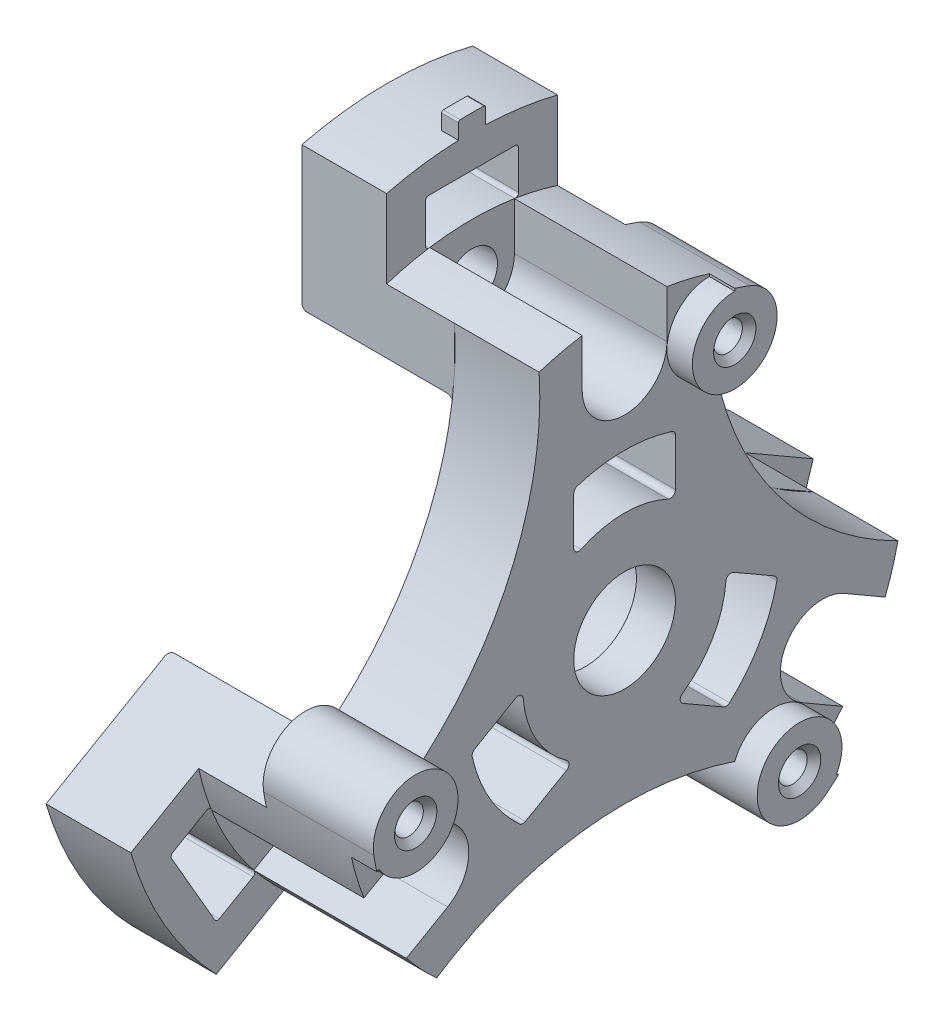
from build123d import *
from build123d.topology import SkipClean

# Parameters (mm, degrees)
SKETCH_2_R                           = 20
CUT_EXTRUDE_1_DEPTH                  = 10
PATTERN_CIRCULAR_1_COUNT             = 3
CUT_EXTRUDE_START                    = -10
CUT_EXTRUDE_2_DEPTH                  = 10
PATTERN_CIRCULAR_2_COUNT             = 3
SKETCH_4_R                           = 1.5
EXTRUDE_1_DEPTH                      = 9
PATTERN_CIRCULAR_3_COUNT             = 3
CUT_EXTRUDE_START_2                  = -1.7
CUT_EXTRUDE_3_DEPTH                  = 1.7
PATTERN_CIRCULAR_4_COUNT             = 3
CUT_EXTRUDE_4_DEPTH                  = 9
PATTERN_CIRCULAR_5_COUNT             = 3
EXTRUDE_START                        = -6.5
EXTRUDE_2_DEPTH                      = 6.5
SKETCH_9_R                           = 0.85
CUT_EXTRUDE_7_DEPTH                  = 6.4
CHAMFER_3_SIZE                       = 0.4
PATTERN_CIRCULAR_8_COUNT             = 3
CHAMFER_3_OF_PATTERN_CIRCULAR_8_SIZE = 0.4
CHAMFER_4_SIZE                       = 0.3
CHAMFER_4_SIZE2                      = 0.519615242
FILLET_6_R                           = 0.5
FILLET_7_R                           = 0.5
EXTRUDE_START_2                      = -5
EXTRUDE_3_DEPTH                      = 5
PATTERN_CIRCULAR_9_COUNT             = 3
EXTRUDE_4_DEPTH                      = 1
FILLET_9_R                           = 0.3
FILLET_10_R                          = 0.2


with BuildPart() as part:
    # 草图1 → 旋转1 (revolve)
    with BuildSketch(Plane.XY, mode=Mode.PRIVATE) as revolve_1_sk:
        Polygon((-7, 6), (-5, 6), (-5, 16.5), (0, 16.5), (0, 3), (-2.3, 3), (-2.3, 3.975), (-7, 3.975), align=None)
    revolve(revolve_1_sk.sketch.rotate(Axis((-65.742857143, 0, 0), (1, 0, 0)), 90), axis=Axis((-65.742857143, 0, 0), (1, 0, 0)))

    # 草图2 → 切除-拉伸1 (cut)
    with BuildSketch(Plane.ZY.offset(5)):
        with Locations((-25, 14.43375673)):
            Circle(SKETCH_2_R)
    cut_extrude_1 = extrude(amount=-CUT_EXTRUDE_1_DEPTH, mode=Mode.SUBTRACT)

    # 阵列(圆周)1: 切除-拉伸1 ×3 about axis
    pattern_circular_1_axis = Axis((0, 0, 0), (1, 0, 0))
    for i in range(1, PATTERN_CIRCULAR_1_COUNT):
        add(cut_extrude_1.rotate(pattern_circular_1_axis, i * 360 / PATTERN_CIRCULAR_1_COUNT), mode=Mode.SUBTRACT)

    # 草图3 → 切除-拉伸2 (cut)
    with BuildSketch(Plane.ZY.offset(5).offset(CUT_EXTRUDE_START)):
        with BuildLine():
            Line((-3, 8.480566019), (-3, 5.692099788))
            ThreePointArc((-3, 5.692099788), (-2.860356745, 5.438553512), (-2.571428571, 5.421047417))
            ThreePointArc((-2.571428571, 5.421047417), (0, 6), (2.571428571, 5.421047417))
            ThreePointArc((2.571428571, 5.421047417), (2.860356745, 5.438553512), (3, 5.692099788))
            Line((3, 5.692099788), (3, 8.480566019))
            ThreePointArc((3, 8.480566019), (2.9421811, 8.657620571), (2.791011236, 8.766427795))
            ThreePointArc((2.791011236, 8.766427795), (0, 9.2), (-2.791011236, 8.766427795))
            ThreePointArc((-2.791011236, 8.766427795), (-2.9421811, 8.657620571), (-3, 8.480566019))
        make_face()
    cut_extrude_2 = extrude(amount=CUT_EXTRUDE_2_DEPTH, mode=Mode.SUBTRACT)

    # 阵列(圆周)2: 切除-拉伸2 ×3 about axis
    pattern_circular_2_axis = Axis((0, 0, 0), (1, 0, 0))
    for i in range(1, PATTERN_CIRCULAR_2_COUNT):
        add(cut_extrude_2.rotate(pattern_circular_2_axis, i * 360 / PATTERN_CIRCULAR_2_COUNT), mode=Mode.SUBTRACT)

    # 草图4 → 凸台-拉伸1 (add)
    with BuildSketch(Plane.ZY.offset(5)):
        with BuildLine():
            Line((-5.040834524, 15.711142139), (-5.040834524, 11.928641469))
            ThreePointArc((-5.040834524, 11.928641469), (-3.875431802, 12.356517647), (-2.674412578, 12.670833333))
            ThreePointArc((-2.674412578, 12.670833333), (0, 10.7), (2.674412578, 12.670833333))
            ThreePointArc((2.674412578, 12.670833333), (3.875431802, 12.356517647), (5.040834524, 11.928641469))
            Line((5.040834524, 11.928641469), (5.040834524, 15.711142139))
            ThreePointArc((5.040834524, 15.711142139), (0, 16.5), (-5.040834524, 15.711142139))
        make_face()
        with Locations((0, 13.5)):
            Circle(SKETCH_4_R, mode=Mode.SUBTRACT)
    extrude_1 = extrude(amount=EXTRUDE_1_DEPTH)

    # 阵列(圆周)3: 凸台-拉伸1 ×3 about axis
    pattern_circular_3_axis = Axis((0, 0, 0), (1, 0, 0))
    for i in range(1, PATTERN_CIRCULAR_3_COUNT):
        add(extrude_1.rotate(pattern_circular_3_axis, i * 360 / PATTERN_CIRCULAR_3_COUNT))

    # 草图5 → 切除-拉伸3 (cut)
    with BuildSketch(Plane.ZY.offset(14).offset(CUT_EXTRUDE_START_2)):
        with BuildLine():
            Line((-2.8, 12.643674308), (-2.8, 9.290818443))
            Line((-2.8, 9.290818443), (2.8, 9.290818443))
            Line((2.8, 9.290818443), (2.8, 12.643674308))
            ThreePointArc((2.8, 12.643674308), (0, 12.95), (-2.8, 12.643674308))
        make_face()
    cut_extrude_3 = extrude(amount=CUT_EXTRUDE_3_DEPTH, mode=Mode.SUBTRACT)

    # 阵列(圆周)4: 切除-拉伸3 ×3 about axis
    pattern_circular_4_axis = Axis((-65.742857143, 0, 0), (-1, 0, 0))
    for i in range(1, PATTERN_CIRCULAR_4_COUNT):
        add(cut_extrude_3.rotate(pattern_circular_4_axis, i * 360 / PATTERN_CIRCULAR_4_COUNT), mode=Mode.SUBTRACT)

    # 草图6 → 切除-拉伸4 (cut)
    with BuildSketch(Plane(origin=(0, 0, 0), x_dir=(0, 0, -1), z_dir=(1, 0, 0))):
        with BuildLine():
            Line((-2.5, 16.30950643), (-2.5, 13.5))
            ThreePointArc((-2.5, 13.5), (0, 11), (2.5, 13.5))
            Line((2.5, 13.5), (2.5, 16.30950643))
            ThreePointArc((2.5, 16.30950643), (0, 16.5), (-2.5, 16.30950643))
        make_face()
    cut_extrude_4 = extrude(amount=-CUT_EXTRUDE_4_DEPTH, mode=Mode.SUBTRACT)

    # 阵列(圆周)5: 切除-拉伸4 ×3 about axis
    pattern_circular_5_axis = Axis((0, 0, 0), (1, 0, 0))
    for i in range(1, PATTERN_CIRCULAR_5_COUNT):
        add(cut_extrude_4.rotate(pattern_circular_5_axis, i * 360 / PATTERN_CIRCULAR_5_COUNT), mode=Mode.SUBTRACT)

    # 草图7 → 凸台-拉伸2 (add)
    with BuildSketch(Plane.ZY.offset(5).offset(EXTRUDE_START)):
        with BuildLine():
            Line((-5, 15.576696831), (-5, 15.724185194))
            ThreePointArc((-5, 15.724185194), (-5.448667451, 15.574402814), (-5.892857143, 15.411821265))
            ThreePointArc((-5.892857143, 15.411821265), (-4.546023726, 10.618261242), (-5, 15.576696831))
        make_face()
    extrude_2 = extrude(amount=EXTRUDE_2_DEPTH)

    # 草图9 → 切除-拉伸7 (cut)
    with SkipClean():  # the faces are left unmerged after this step: merging them gives an invalid solid
        with BuildSketch(Plane(origin=(1.5, 0, 0), x_dir=(0, 0, -1), z_dir=(1, 0, 0))):
            with Locations((5, 13.076696831)):
                Circle(SKETCH_9_R)
        cut_extrude_7 = extrude(amount=-CUT_EXTRUDE_7_DEPTH, mode=Mode.SUBTRACT)

    # 倒角3
    chamfer_3_edges = [part.edges().sort_by_distance(p)[0] for p in [
        (1.5, 13.076696831, -4.15),
    ]]
    chamfer(chamfer_3_edges, length=CHAMFER_3_SIZE)

    # 阵列(圆周)8: 凸台-拉伸2, 切除-拉伸7 ×3 about axis
    with SkipClean():  # the faces are left unmerged after this step: merging them gives an invalid solid
        pattern_circular_8_axis = Axis((0, 0, 0), (1, 0, 0))
        add([extrude_2.rotate(pattern_circular_8_axis, i * 360 / PATTERN_CIRCULAR_8_COUNT) for i in range(1, PATTERN_CIRCULAR_8_COUNT)])
        add([cut_extrude_7.rotate(pattern_circular_8_axis, i * 360 / PATTERN_CIRCULAR_8_COUNT) for i in range(1, PATTERN_CIRCULAR_8_COUNT)], mode=Mode.SUBTRACT)

    # 倒角3 of 阵列(圆周)8
    chamfer_3_of_pattern_circular_8_edges = [part.edges().sort_by_distance(p)[0] for p in [
        (1.5, -2.94434299, 13.399751653),
        (1.5, -10.132353841, -9.249751653),
    ]]
    chamfer(chamfer_3_of_pattern_circular_8_edges, length=CHAMFER_3_OF_PATTERN_CIRCULAR_8_SIZE)

    # 倒角4
    chamfer_4_edges = [part.edges().sort_by_distance(p)[0] for p in [
        (-7, 0, -3.975),
    ]]
    chamfer_4_side = [part.faces().sort_by_distance(p)[0] for p in [
        (-7, 0, -4.144705627),
    ]]
    chamfer(chamfer_4_edges, length=CHAMFER_4_SIZE, length2=CHAMFER_4_SIZE2, reference=chamfer_4_side[0])

    # 圆角6
    # the kernel refuses this fillet: 0.5 mm, written as the material it adds along each edge
    with BuildSketch(Plane(origin=(-5, 0, 0), x_dir=(0, 0.8793281137807236, -0.47621640911967206), z_dir=(0, -0.47621640911967206, -0.8793281137807236))) as fillet_6_piece_1_section:
        with BuildLine():
            CenterArc((12.95 - FILLET_6_R, -FILLET_6_R), FILLET_6_R, 0, 90)
            Line((12.95, -FILLET_6_R), (12.95, 0))
            Line((12.95, 0), (12.95 - FILLET_6_R, 0))
        make_face()
    fillet_6_piece_1 = revolve(axis=Axis((-5, 0, 0), (1, 0, 0)), revolution_arc=22.050697628, mode=Mode.PRIVATE)
    fillet_6_piece_1 = split(fillet_6_piece_1, bisect_by=Plane(origin=(-5.112168205, 12.222030321, -5.040834524), z_dir=(0, 0, 1)), keep=Keep.TOP, mode=Mode.PRIVATE)
    fillet_6_piece_1 = fillet_6_piece_1 - Plane(origin=(-5.112168205, 13.5, 0), x_dir=(0, -0.2961309523809526, -0.9551473493874911), z_dir=(1, 0, 0)) * Cylinder(2.8, 52, mode=Mode.PRIVATE)
    add(fillet_6_piece_1)
    with BuildSketch(Plane(origin=(-5, 13.5, 0), x_dir=(0, 0.1457375577042098, 0.9893232860265708), z_dir=(0, 0.9893232860265708, -0.1457375577042098))) as fillet_6_piece_2:
        with BuildLine():
            CenterArc((2.8 + FILLET_6_R, -FILLET_6_R), FILLET_6_R, 90, 90)
            Line((2.8, -FILLET_6_R), (2.8, 0))
            Line((2.8, 0), (2.8 + FILLET_6_R, 0))
        make_face()
    revolve(axis=Axis((-5, 13.5, 0), (1, 0, 0)), revolution_arc=196.759983694)
    with BuildSketch(Plane(origin=(-5, 0, 0), x_dir=(0, 0.9937914719955359, 0.11125875331382269), z_dir=(0, 0.11125875331382269, -0.9937914719955359))) as fillet_6_piece_3_section:
        with BuildLine():
            CenterArc((12.95 - FILLET_6_R, -FILLET_6_R), FILLET_6_R, 0, 90)
            Line((12.95, -FILLET_6_R), (12.95, 0))
            Line((12.95, 0), (12.95 - FILLET_6_R, 0))
        make_face()
    fillet_6_piece_3 = revolve(axis=Axis((-5, 0, 0), (1, 0, 0)), revolution_arc=22.050697628, mode=Mode.PRIVATE)
    fillet_6_piece_3 = split(fillet_6_piece_3, bisect_by=Plane(origin=(-5.11216821, 12.222030475, 5.040834524), z_dir=(0, 0, -1)), keep=Keep.TOP, mode=Mode.PRIVATE)
    fillet_6_piece_3 = fillet_6_piece_3 - Plane(origin=(-5.11216821, 13.5, 0), x_dir=(0, -0.2961309523809526, -0.9551473493874911), z_dir=(1, 0, 0)) * Cylinder(2.8, 52, mode=Mode.PRIVATE)
    add(fillet_6_piece_3)
    with BuildSketch(Plane(origin=(-5, 0, 0), x_dir=(0, -0.8520795648870015, -0.5234122802361234), z_dir=(0, -0.5234122802361234, 0.8520795648870015))) as fillet_6_piece_4_section:
        with BuildLine():
            CenterArc((12.95 - FILLET_6_R, -FILLET_6_R), FILLET_6_R, 0, 90)
            Line((12.95, -FILLET_6_R), (12.95, 0))
            Line((12.95, 0), (12.95 - FILLET_6_R, 0))
        make_face()
    fillet_6_piece_4 = revolve(axis=Axis((-5, 0, 0), (1, 0, 0)), revolution_arc=22.050697628, mode=Mode.PRIVATE)
    fillet_6_piece_4 = split(fillet_6_piece_4, bisect_by=Plane(origin=(-5.112168205, -10.476505914, -8.064171482), z_dir=(0, 0.8660254037844384, -0.5000000000000004)), keep=Keep.TOP, mode=Mode.PRIVATE)
    fillet_6_piece_4 = fillet_6_piece_4 - Plane(origin=(-5.112168205, -6.75, -11.691342951), x_dir=(0, -0.6791163927364616, 0.7340306023025307), z_dir=(1, 0, 0)) * Cylinder(2.8, 52, mode=Mode.PRIVATE)
    add(fillet_6_piece_4)
    with BuildSketch(Plane(origin=(-5, -6.75, -11.691342951), x_dir=(0, 0.7839103194024034, -0.6208740702706321), z_dir=(0, -0.6208740702706321, -0.7839103194024034))) as fillet_6_piece_5:
        with BuildLine():
            CenterArc((2.8 + FILLET_6_R, -FILLET_6_R), FILLET_6_R, 90, 90)
            Line((2.8, -FILLET_6_R), (2.8, 0))
            Line((2.8, 0), (2.8 + FILLET_6_R, 0))
        make_face()
    revolve(axis=Axis((-5, -6.75, -11.691342951), (1, 0, 0)), revolution_arc=196.759983694)
    with BuildSketch(Plane(origin=(-5, 0, 0), x_dir=(0, -0.4005428292346119, -0.9162780374693769), z_dir=(0, -0.9162780374693769, 0.4005428292346119))) as fillet_6_piece_6_section:
        with BuildLine():
            CenterArc((12.95 - FILLET_6_R, -FILLET_6_R), FILLET_6_R, 0, 90)
            Line((12.95, -FILLET_6_R), (12.95, 0))
            Line((12.95, 0), (12.95 - FILLET_6_R, 0))
        make_face()
    fillet_6_piece_6 = revolve(axis=Axis((-5, 0, 0), (1, 0, 0)), revolution_arc=22.050697628, mode=Mode.PRIVATE)
    fillet_6_piece_6 = split(fillet_6_piece_6, bisect_by=Plane(origin=(-5.11216821, -1.745524484, -13.105006139), z_dir=(0, -0.8660254037844384, 0.5000000000000004)), keep=Keep.TOP, mode=Mode.PRIVATE)
    fillet_6_piece_6 = fillet_6_piece_6 - Plane(origin=(-5.11216821, -6.75, -11.691342951), x_dir=(0, -0.6791163927364616, 0.7340306023025307), z_dir=(1, 0, 0)) * Cylinder(2.8, 52, mode=Mode.PRIVATE)
    add(fillet_6_piece_6)
    with BuildSketch(Plane(origin=(-5, 0, 0), x_dir=(0, -0.027248548893721882, 0.999628689355796), z_dir=(0, 0.999628689355796, 0.027248548893721882))) as fillet_6_piece_7_section:
        with BuildLine():
            CenterArc((12.95 - FILLET_6_R, -FILLET_6_R), FILLET_6_R, 0, 90)
            Line((12.95, -FILLET_6_R), (12.95, 0))
            Line((12.95, 0), (12.95 - FILLET_6_R, 0))
        make_face()
    fillet_6_piece_7 = revolve(axis=Axis((-5, 0, 0), (1, 0, 0)), revolution_arc=22.050697628, mode=Mode.PRIVATE)
    fillet_6_piece_7 = split(fillet_6_piece_7, bisect_by=Plane(origin=(-5.112168205, -1.745524407, 13.105006005), z_dir=(0, -0.8660254037844388, -0.49999999999999983)), keep=Keep.TOP, mode=Mode.PRIVATE)
    fillet_6_piece_7 = fillet_6_piece_7 - Plane(origin=(-5.112168205, -6.75, 11.691342951), x_dir=(0, 0.9752473451174146, 0.22111674708496049), z_dir=(1, 0, 0)) * Cylinder(2.8, 52, mode=Mode.PRIVATE)
    add(fillet_6_piece_7)
    with BuildSketch(Plane(origin=(-5, -6.75, 11.691342951), x_dir=(0, -0.9296478771066136, -0.36844921575593936), z_dir=(0, -0.36844921575593936, 0.9296478771066136))) as fillet_6_piece_8:
        with BuildLine():
            CenterArc((2.8 + FILLET_6_R, -FILLET_6_R), FILLET_6_R, 90, 90)
            Line((2.8, -FILLET_6_R), (2.8, 0))
            Line((2.8, 0), (2.8 + FILLET_6_R, 0))
        make_face()
    revolve(axis=Axis((-5, -6.75, 11.691342951), (1, 0, 0)), revolution_arc=196.759983694)
    with BuildSketch(Plane(origin=(-5, 0, 0), x_dir=(0, -0.5932486427609238, 0.8050192841555547), z_dir=(0, 0.8050192841555547, 0.5932486427609238))) as fillet_6_piece_9_section:
        with BuildLine():
            CenterArc((12.95 - FILLET_6_R, -FILLET_6_R), FILLET_6_R, 0, 90)
            Line((12.95, -FILLET_6_R), (12.95, 0))
            Line((12.95, 0), (12.95 - FILLET_6_R, 0))
        make_face()
    fillet_6_piece_9 = revolve(axis=Axis((-5, 0, 0), (1, 0, 0)), revolution_arc=22.050697628, mode=Mode.PRIVATE)
    fillet_6_piece_9 = split(fillet_6_piece_9, bisect_by=Plane(origin=(-5.11216821, -10.476505991, 8.064171615), z_dir=(0, 0.8660254037844388, 0.49999999999999983)), keep=Keep.TOP, mode=Mode.PRIVATE)
    fillet_6_piece_9 = fillet_6_piece_9 - Plane(origin=(-5.11216821, -6.75, 11.691342951), x_dir=(0, 0.9752473451174146, 0.22111674708496049), z_dir=(1, 0, 0)) * Cylinder(2.8, 52, mode=Mode.PRIVATE)
    add(fillet_6_piece_9)

    # 圆角7
    fillet_7_edges = [part.edges().sort_by_distance(p)[0] for p in [
        (-7, 0, -6),
    ]]
    fillet(fillet_7_edges, radius=FILLET_7_R)

    # 草图11 → 凸台-拉伸3 (add)
    with BuildSketch(Plane.ZY.offset(14).offset(EXTRUDE_START_2)):
        with BuildLine():
            Line((-5.040834524, 15.711142139), (-5.040834524, 20.334514681))
            ThreePointArc((-5.040834524, 20.334514681), (-2.539135427, 20.795559413), (0, 20.95))
            ThreePointArc((0, 20.95), (2.539135427, 20.795559413), (5.040834524, 20.334514681))
            Line((5.040834524, 20.334514681), (5.040834524, 15.711142139))
            ThreePointArc((5.040834524, 15.711142139), (3.905398597, 16.031152853), (2.75, 16.269219404))
            Line((2.75, 16.269219404), (2.75, 18.8))
            ThreePointArc((2.75, 18.8), (2.691421356, 18.941421356), (2.55, 19))
            Line((2.55, 19), (-2.55, 19))
            ThreePointArc((-2.55, 19), (-2.691421356, 18.941421356), (-2.75, 18.8))
            Line((-2.75, 18.8), (-2.75, 16.269219404))
            ThreePointArc((-2.75, 16.269219404), (-3.905398597, 16.031152853), (-5.040834524, 15.711142139))
        make_face()
    extrude_3 = extrude(amount=EXTRUDE_3_DEPTH)

    # 阵列(圆周)9: 凸台-拉伸3 ×3 about axis
    pattern_circular_9_axis = Axis((0, 0, 0), (1, 0, 0))
    for i in range(1, PATTERN_CIRCULAR_9_COUNT):
        add(extrude_3.rotate(pattern_circular_9_axis, i * 360 / PATTERN_CIRCULAR_9_COUNT))

    # 草图12 → 凸台-拉伸4 (add)
    with BuildSketch(Plane(origin=(-9, 0, 0), x_dir=(0, 0, -1), z_dir=(1, 0, 0))):
        with BuildLine():
            Line((-0.8, 21.838784307), (-0.8, 20.934719965))
            ThreePointArc((-0.8, 20.934719965), (0, 20.95), (0.8, 20.934719965))
            Line((0.8, 20.934719965), (0.8, 21.838784307))
            ThreePointArc((0.8, 21.838784307), (0.771834414, 21.9083531), (0.703203661, 21.938732976))
            ThreePointArc((0.703203661, 21.938732976), (0, 21.95), (-0.703203661, 21.938732976))
            ThreePointArc((-0.703203661, 21.938732976), (-0.771834414, 21.9083531), (-0.8, 21.838784307))
        make_face()
    extrude(amount=-EXTRUDE_4_DEPTH)

    # 圆角9
    fillet_9_edges = [part.edges().sort_by_distance(p)[0] for p in [
        (-14, 12.538695277, -3.237841991),
        (-14, 12.538695277, 3.237841991),
        (-14, -9.073401056, -9.239907645),
        (-14, -3.465294221, -12.477749635),
        (-14, -3.465294221, 12.477749635),
        (-14, -9.073401056, 9.239907645),
    ]]
    fillet(fillet_9_edges, radius=FILLET_9_R)

    # 圆角10
    fillet_10_edges = [part.edges().sort_by_distance(p)[0] for p in [
        (-11.5, 16.269219404, -2.75),
        (-11.5, 16.269219404, 2.75),
        (-11.5, -10.516179562, -12.714557303),
        (-11.5, -5.753039841, -15.464557303),
        (-11.5, -5.753039841, 15.464557303),
        (-11.5, -10.516179562, 12.714557303),
    ]]
    fillet(fillet_10_edges, radius=FILLET_10_R)


solid = part.part
